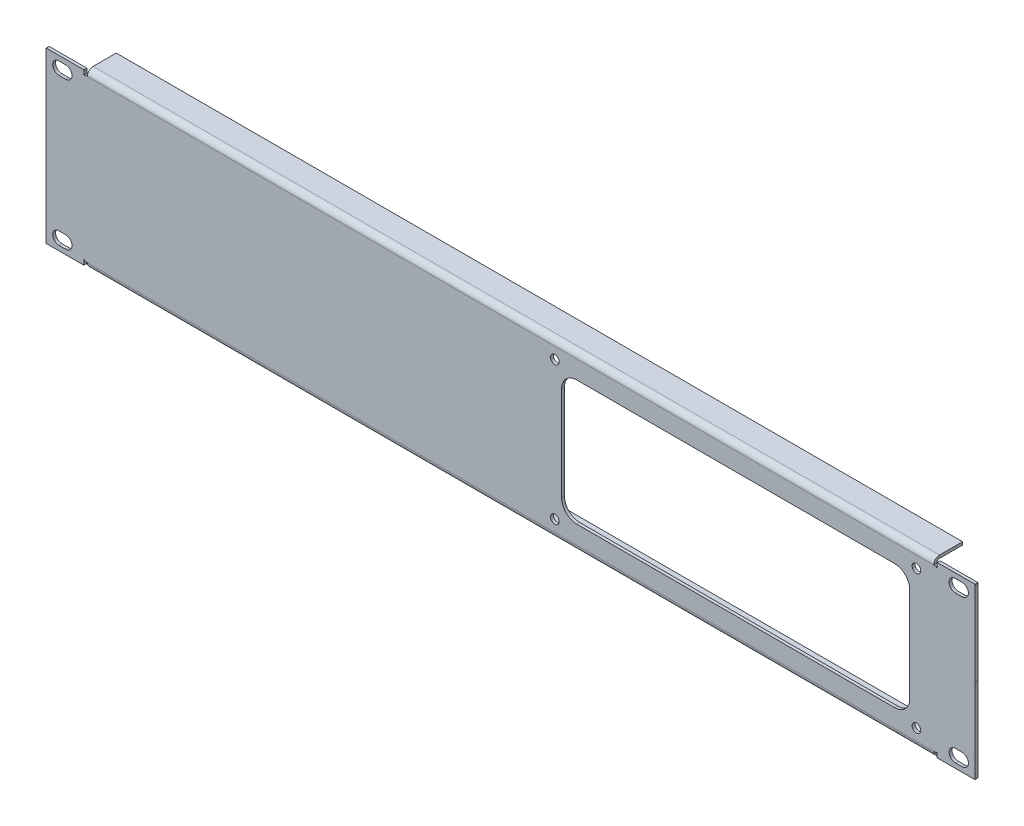
from build123d import *

# Parameters (mm, degrees)
BOSS_EXTRUDE1_DEPTH     = 2
CONVERT_SOLID1_DEPTH    = 0.5
EDGE_FLANGE1_DEPTH      = 440
EDGE_FLANGE1_BEND_DEPTH = 440
SKETCH12_R              = 2.25
CUT_EXTRUDE1_DEPTH      = 1.5


# Read off the part's stored shape, not the designer's step: Convert-Solid1
# Sheet-metal steps are written as plain solids
with BuildPart() as part:
    # Model → Boss-Extrude1 (new body)
    with BuildSketch(Plane.XY):
        with BuildLine():
            Line((221.66, -19.508939372), (221.66, -21.75))
            ThreePointArc((221.66, -21.75), (221.733223305, -21.926776695), (221.91, -22))
            Line((221.91, -22), (241.25, -22))
            ThreePointArc((241.25, -22), (241.426776695, -21.926776695), (241.5, -21.75))
            Line((241.5, -21.75), (241.5, 21.75))
            Line((241.5, 21.75), (241.500000169, 22.249478564))
            Line((241.500000169, 22.249478564), (241.500000169, 65.749478564))
            ThreePointArc((241.500000169, 65.749478564), (241.426776865, 65.926255259), (241.250000169, 65.999478564))
            Line((241.250000169, 65.999478564), (221.910000169, 65.999478564))
            ThreePointArc((221.910000169, 65.999478564), (221.733223474, 65.926255259), (221.660000169, 65.749478564))
            Line((221.660000169, 65.749478564), (221.660000169, 63.508417937))
            ThreePointArc((221.660000169, 63.508417937), (221.580000169, 63.428417937), (221.500000169, 63.508417937))
            Line((221.500000169, 63.508417937), (221.500000169, 63.928417937))
            Line((221.500000169, 63.928417937), (-221.499999831, 63.928417937))
            Line((-221.499999831, 63.928417937), (-221.499999831, 63.508417937))
            ThreePointArc((-221.499999831, 63.508417937), (-221.579999831, 63.428417937), (-221.659999831, 63.508417937))
            Line((-221.659999831, 63.508417937), (-221.659999831, 65.749478564))
            ThreePointArc((-221.659999831, 65.749478564), (-221.733223135, 65.926255259), (-221.909999831, 65.999478564))
            Line((-221.909999831, 65.999478564), (-241.249999831, 65.999478564))
            ThreePointArc((-241.249999831, 65.999478564), (-241.426776526, 65.926255259), (-241.499999831, 65.749478564))
            Line((-241.499999831, 65.749478564), (-241.499999831, 22.249478564))
            Line((-241.499999831, 22.249478564), (-241.5, 21.75))
            Line((-241.5, 21.75), (-241.5, -21.75))
            ThreePointArc((-241.5, -21.75), (-241.426776695, -21.926776695), (-241.25, -22))
            Line((-241.25, -22), (-221.91, -22))
            ThreePointArc((-221.91, -22), (-221.733223305, -21.926776695), (-221.66, -21.75))
            Line((-221.66, -21.75), (-221.66, -19.508939372))
            ThreePointArc((-221.66, -19.508939372), (-221.58, -19.428939372), (-221.5, -19.508939372))
            Line((-221.5, -19.508939372), (-221.5, -19.928939372))
            Line((-221.5, -19.928939372), (221.5, -19.928939372))
            Line((221.5, -19.928939372), (221.5, -19.508939372))
            ThreePointArc((221.5, -19.508939372), (221.58, -19.428939372), (221.66, -19.508939372))
        make_face()
        with BuildLine():
            Line((-231.25, -19.5), (-234.75, -19.5))
            ThreePointArc((-234.75, -19.5), (-238, -16.25), (-234.75, -13))
            Line((-234.75, -13), (-231.25, -13))
            ThreePointArc((-231.25, -13), (-228, -16.25), (-231.25, -19.5))
        make_face(mode=Mode.SUBTRACT)
        with BuildLine():
            Line((231.25, -13), (234.75, -13))
            ThreePointArc((234.75, -13), (238, -16.25), (234.75, -19.5))
            Line((234.75, -19.5), (231.25, -19.5))
            ThreePointArc((231.25, -19.5), (228, -16.25), (231.25, -13))
        make_face(mode=Mode.SUBTRACT)
        with BuildLine():
            Line((-231.249999831, 56.999478564), (-234.749999831, 56.999478564))
            ThreePointArc((-234.749999831, 56.999478564), (-237.999999831, 60.249478564), (-234.749999831, 63.499478564))
            Line((-234.749999831, 63.499478564), (-231.249999831, 63.499478564))
            ThreePointArc((-231.249999831, 63.499478564), (-227.999999831, 60.249478564), (-231.249999831, 56.999478564))
        make_face(mode=Mode.SUBTRACT)
        with BuildLine():
            Line((234.750000169, 56.999478564), (231.250000169, 56.999478564))
            ThreePointArc((231.250000169, 56.999478564), (228.000000169, 60.249478564), (231.250000169, 63.499478564))
            Line((231.250000169, 63.499478564), (234.750000169, 63.499478564))
            ThreePointArc((234.750000169, 63.499478564), (238.000000169, 60.249478564), (234.750000169, 56.999478564))
        make_face(mode=Mode.SUBTRACT)
    extrude(amount=BOSS_EXTRUDE1_DEPTH)

    # Convert-Solid1 outline → Convert-Solid1 (cut)
    with BuildSketch(Plane.XY):
        with BuildLine():
            Line((221.5, -19.928939372), (221.5, -19.508939372))
            ThreePointArc((221.5, -19.508939372), (221.58, -19.428939372), (221.66, -19.508939372))
            Line((221.66, -19.508939372), (221.66, -21.75))
            ThreePointArc((221.66, -21.75), (221.733223305, -21.926776695), (221.91, -22))
            Line((221.91, -22), (241.25, -22))
            ThreePointArc((241.25, -22), (241.426776695, -21.926776695), (241.5, -21.75))
            Line((241.5, -21.75), (241.5, 21.75))
            Line((241.5, 21.75), (241.500000169, 65.749478564))
            ThreePointArc((241.500000169, 65.749478564), (241.426776864, 65.926255259), (241.250000169, 65.999478564))
            Line((241.250000169, 65.999478564), (221.910000169, 65.999478564))
            ThreePointArc((221.910000169, 65.999478564), (221.733223474, 65.926255259), (221.660000169, 65.749478564))
            Line((221.660000169, 65.749478564), (221.660000169, 63.508417937))
            ThreePointArc((221.660000169, 63.508417937), (221.580000169, 63.428417937), (221.500000169, 63.508417937))
            Line((221.500000169, 63.508417937), (221.500000169, 63.928417937))
            Line((221.500000169, 63.928417937), (-221.499999831, 63.928417937))
            Line((-221.499999831, 63.928417937), (-221.499999831, 63.508417937))
            ThreePointArc((-221.499999831, 63.508417937), (-221.579999831, 63.428417937), (-221.659999831, 63.508417937))
            Line((-221.659999831, 63.508417937), (-221.659999831, 65.749478564))
            ThreePointArc((-221.659999831, 65.749478564), (-221.733223135, 65.926255259), (-221.909999831, 65.999478564))
            Line((-221.909999831, 65.999478564), (-241.249999831, 65.999478564))
            ThreePointArc((-241.249999831, 65.999478564), (-241.426776526, 65.926255259), (-241.499999831, 65.749478564))
            Line((-241.499999831, 65.749478564), (-241.499999831, 22.249478564))
            Line((-241.499999831, 22.249478564), (-241.5, -21.75))
            ThreePointArc((-241.5, -21.75), (-241.426776695, -21.926776695), (-241.25, -22))
            Line((-241.25, -22), (-221.91, -22))
            ThreePointArc((-221.91, -22), (-221.733223305, -21.926776695), (-221.66, -21.75))
            Line((-221.66, -21.75), (-221.66, -19.508939372))
            ThreePointArc((-221.66, -19.508939372), (-221.58, -19.428939372), (-221.5, -19.508939372))
            Line((-221.5, -19.508939372), (-221.5, -19.928939372))
            Line((-221.5, -19.928939372), (221.5, -19.928939372))
        make_face()
        with BuildLine():
            Line((-234.75, -13), (-231.25, -13))
            ThreePointArc((-231.25, -13), (-228, -16.25), (-231.25, -19.5))
            Line((-231.25, -19.5), (-234.75, -19.5))
            ThreePointArc((-234.75, -19.5), (-238, -16.25), (-234.75, -13))
        make_face(mode=Mode.SUBTRACT)
        with BuildLine():
            ThreePointArc((231.25, -19.5), (228, -16.25), (231.25, -13))
            Line((231.25, -13), (234.75, -13))
            ThreePointArc((234.75, -13), (238, -16.25), (234.75, -19.5))
            Line((234.75, -19.5), (231.25, -19.5))
        make_face(mode=Mode.SUBTRACT)
        with BuildLine():
            Line((-234.749999831, 63.499478564), (-231.249999831, 63.499478564))
            ThreePointArc((-231.249999831, 63.499478564), (-227.999999831, 60.249478564), (-231.249999831, 56.999478564))
            Line((-231.249999831, 56.999478564), (-234.749999831, 56.999478564))
            ThreePointArc((-234.749999831, 56.999478564), (-237.999999831, 60.249478564), (-234.749999831, 63.499478564))
        make_face(mode=Mode.SUBTRACT)
        with BuildLine():
            ThreePointArc((231.250000169, 56.999478564), (228.000000169, 60.249478564), (231.250000169, 63.499478564))
            Line((231.250000169, 63.499478564), (234.750000169, 63.499478564))
            ThreePointArc((234.750000169, 63.499478564), (238.000000169, 60.249478564), (234.750000169, 56.999478564))
            Line((234.750000169, 56.999478564), (231.250000169, 56.999478564))
        make_face(mode=Mode.SUBTRACT)
    extrude(amount=CONVERT_SOLID1_DEPTH, mode=Mode.SUBTRACT)

    # Edge-Flange1 section (across the edge) → Edge-Flange1 (add)
    with BuildSketch(Plane(origin=(-219.999999831, 65.428417937, 0.5), x_dir=(0, -1, 0), z_dir=(1, 0, 0))):
        with BuildLine():
            Line((-1.5, 1.5), (-1.5, 13.5))
            Line((-1.5, 13.5), (0, 13.5))
            Line((0, 13.5), (0, 1.5))
            ThreePointArc((0, 1.5), (0.439339828, 0.439339828), (1.5, 0))
            Line((1.5, 0), (1.5, -1.5))
            ThreePointArc((1.5, -1.5), (-0.621320344, -0.621320344), (-1.5, 1.5))
        make_face()
    extrude(amount=EDGE_FLANGE1_DEPTH)

    # Edge-Flange1 section 2 (across the edge) → Edge-Flange1 bend (add)
    with BuildSketch(Plane(origin=(220, -21.428939372, 0.5), x_dir=(0, 1, 0), z_dir=(-1, 0, 0))):
        with BuildLine():
            Line((-1.5, 1.5), (-1.5, 13.5))
            Line((-1.5, 13.5), (0, 13.5))
            Line((0, 13.5), (0, 1.5))
            ThreePointArc((0, 1.5), (0.439339828, 0.439339828), (1.5, 0))
            Line((1.5, 0), (1.5, -1.5))
            ThreePointArc((1.5, -1.5), (-0.621320344, -0.621320344), (-1.5, 1.5))
        make_face()
    extrude(amount=EDGE_FLANGE1_BEND_DEPTH)

    # Sketch12 → Cut-Extrude1 (cut)
    with BuildSketch(Plane.XY.offset(2)):
        with Locations((211.000000169, 57.937539282)):
            Circle(SKETCH12_R)
        with Locations((23.040000169, 57.937539282)):
            Circle(SKETCH12_R)
        with Locations((23.040000169, -13.938060718)):
            Circle(SKETCH12_R)
        with Locations((211.000000169, -13.938060718)):
            Circle(SKETCH12_R)
        with BuildLine():
            Line((34.420000169, 54.437539282), (199.620000169, 54.437539282))
            ThreePointArc((199.620000169, 54.437539282), (205.192001605, 52.129540718), (207.500000169, 46.557539282))
            Line((207.500000169, 46.557539282), (207.500000169, -2.558060718))
            ThreePointArc((207.500000169, -2.558060718), (205.192001605, -8.130062154), (199.620000169, -10.438060718))
            Line((199.620000169, -10.438060718), (34.420000169, -10.438060718))
            ThreePointArc((34.420000169, -10.438060718), (28.847998734, -8.130062154), (26.540000169, -2.558060718))
            Line((26.540000169, -2.558060718), (26.540000169, 46.557539282))
            ThreePointArc((26.540000169, 46.557539282), (28.847998734, 52.129540718), (34.420000169, 54.437539282))
        make_face()
    extrude(amount=-CUT_EXTRUDE1_DEPTH, mode=Mode.SUBTRACT)


solid = part.part
